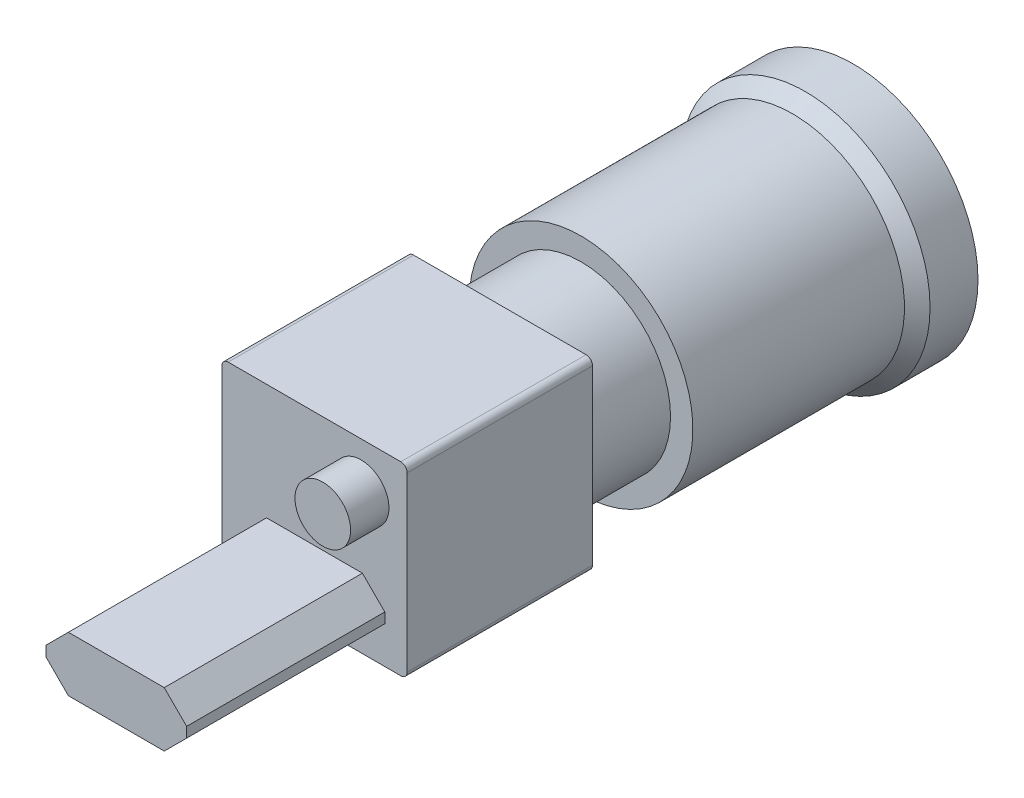
from build123d import *

# Parameters (mm, degrees)
SKETCH_1_W          = 29
SKETCH_1_H          = 29
EXTRUDE_1_DEPTH     = 29
SKETCH_2_R          = 1.7
CUT_EXTRUDE_1_DEPTH = 4
SKETCH_3_R          = 14
EXTRUDE_2_DEPTH     = 12.7
SKETCH_4_R          = 17.5
EXTRUDE_3_DEPTH     = 32.6
SKETCH_6_R          = 19.5
EXTRUDE_4_DEPTH     = 10
CHAMFER_1_SIZE      = 2.5
FILLET_1_R          = 1
SKETCH_7_W          = 22
SKETCH_7_H          = 8.6
EXTRUDE_5_DEPTH     = 31
SKETCH_8_R          = 4.35
EXTRUDE_6_DEPTH     = 6
CHAMFER_2_SIZE      = 3.5


with BuildPart() as part:
    # 草图1 → 凸台-拉伸1 (new body)
    with BuildSketch(Plane(origin=(0, 0, 0), x_dir=(1, 0, 0), z_dir=(0, 1, 0))):
        Rectangle(SKETCH_1_W, SKETCH_1_H)
    extrude(amount=EXTRUDE_1_DEPTH)

    # 草图2 → 切除-拉伸1 (cut)
    with BuildSketch(Plane.XZ):
        with Locations(Location((-10, -11.5, 0), (0, 0, 270))):
            Circle(SKETCH_2_R)
        with Locations(Location((10, -11.5, 0), (0, 0, 270))):
            Circle(SKETCH_2_R)
        with Locations(Location((0, 12, 0), (0, 0, 270))):
            Circle(SKETCH_2_R)
    extrude(amount=-CUT_EXTRUDE_1_DEPTH, mode=Mode.SUBTRACT)

    # 草图3 → 凸台-拉伸2 (add)
    with BuildSketch(Plane(origin=(0, 0, -14.5), x_dir=(-1, 0, 0), z_dir=(0, 0, -1))):
        with Locations((0, 14.5)):
            Circle(SKETCH_3_R)
    extrude(amount=EXTRUDE_2_DEPTH)

    # 草图4 → 凸台-拉伸3 (add)
    with BuildSketch(Plane(origin=(0, 0, -27.2), x_dir=(-1, 0, 0), z_dir=(0, 0, -1))):
        with Locations((0, 14.5)):
            Circle(SKETCH_4_R)
    extrude(amount=EXTRUDE_3_DEPTH)

    # 草图6 → 凸台-拉伸4 (add)
    with BuildSketch(Plane(origin=(0, 0, -59.8), x_dir=(-1, 0, 0), z_dir=(0, 0, -1))):
        with Locations((0, 14.5)):
            Circle(SKETCH_6_R)
    extrude(amount=EXTRUDE_4_DEPTH)

    # 倒角1
    # the kernel refuses this chamfer: 2.5 mm, written as the material it takes off along each edge
    with BuildSketch(Plane(origin=(0, 14.5, -59.8), x_dir=(-1, 0, 0), z_dir=(0, -1, 0))) as chamfer_1_piece_1_section:
        Polygon((19.5, CHAMFER_1_SIZE), (19.5 - CHAMFER_1_SIZE, 0), (19.5, 0), align=None)
    chamfer_1_piece_1 = revolve(axis=Axis((0, 14.5, -59.8), (0, 0, -1)), mode=Mode.PRIVATE)
    chamfer_1_piece_1 = chamfer_1_piece_1 - Plane(origin=(0, 14.5, -61.283957384), x_dir=(-1, 0, 0), z_dir=(0, 0, 1)) * Cylinder(17.5, 78, mode=Mode.PRIVATE)
    add(chamfer_1_piece_1, mode=Mode.SUBTRACT)

    # 圆角1
    fillet_1_edges = [part.edges().sort_by_distance(p)[0] for p in [
        (-14.5, 29, 0),
        (14.5, 29, 0),
        (-14.5, 0, 0),
        (14.5, 0, 0),
    ]]
    fillet(fillet_1_edges, radius=FILLET_1_R)

    # 草图7 → 凸台-拉伸5 (add)
    with BuildSketch(Plane.XY.offset(14.5)):
        with Locations((0, 6.6)):
            Rectangle(SKETCH_7_W, SKETCH_7_H)
    extrude(amount=EXTRUDE_5_DEPTH)

    # 草图8 → 凸台-拉伸6 (add)
    with BuildSketch(Plane.XY.offset(14.5)):
        with Locations(Location((7.3, 21.8, 0), (0, 0, 180))):
            Circle(SKETCH_8_R)
    extrude(amount=EXTRUDE_6_DEPTH)

    # 倒角2
    chamfer_2_edges = [part.edges().sort_by_distance(p)[0] for p in [
        (-11, 10.9, 30),
        (-11, 2.3, 30),
        (11, 2.3, 30),
        (11, 10.9, 30),
    ]]
    chamfer(chamfer_2_edges, length=CHAMFER_2_SIZE)


solid = part.part
